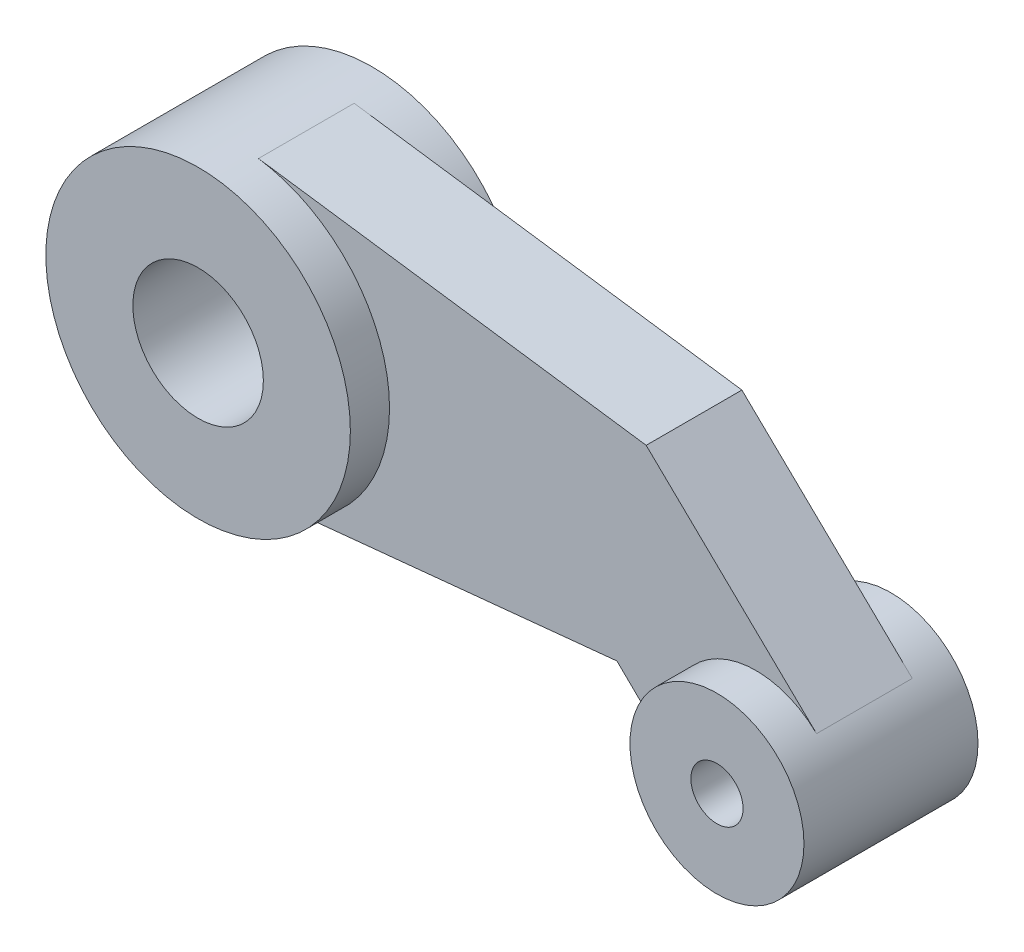
from build123d import *

# Parameters (mm, degrees)
ESQUISSE1_R             = 3
ESQUISSE1_R_2           = 7.5
BOSS_EXTRU_1_DEPTH      = 11
BOSS_EXTRU_2_DEPTH      = 15.5
BOSS_EXTRU_2_DEPTH_BACK = 4.5
ESQUISSE1_3_R           = 17.5
ESQUISSE1_3_R_2         = 7.5
ESQUISSE1_3_R_3         = 10
ESQUISSE1_3_R_4         = 3


with BuildPart() as part:
    # Esquisse1 → Boss.-Extru.1 (new body)
    with BuildSketch(Plane.XY):
        with BuildLine():
            Line((46.997592, 11.066902), (2.435529, 17.329691))
            ThreePointArc((2.435529, 17.329691), (-17.272219, -2.814332), (7.810886, -15.660142))
            Line((7.810886, -15.660142), (43.632384, -12.079599))
            Line((43.632384, -12.079599), (50.273259, -18.558336))
            ThreePointArc((50.273259, -18.558336), (65.124357, -23.392938), (66.578968, -7.842613))
            Line((66.578968, -7.842613), (46.997592, 11.066902))
        make_face()
        with Locations((59.632384, -15.036011)):
            Circle(ESQUISSE1_R, mode=Mode.SUBTRACT)
        Circle(ESQUISSE1_R_2, mode=Mode.SUBTRACT)
    extrude(amount=BOSS_EXTRU_1_DEPTH)

    # Esquisse1<3> → Boss.-Extru.2 (add, two sides: drawn at the far end of the back side and taken through both)
    # profile 1 of 2: a face of its own
    with BuildSketch(Plane.XY.offset(-BOSS_EXTRU_2_DEPTH_BACK)):
        Circle(ESQUISSE1_3_R)
        Circle(ESQUISSE1_3_R_2, mode=Mode.SUBTRACT)
    # profile 2 of 2: a face of its own
    with BuildSketch(Plane.XY.offset(-BOSS_EXTRU_2_DEPTH_BACK)):
        with Locations((59.632384, -15.036011)):
            Circle(ESQUISSE1_3_R_3)
        with Locations((59.632384, -15.036011)):
            Circle(ESQUISSE1_3_R_4, mode=Mode.SUBTRACT)
    extrude(amount=BOSS_EXTRU_2_DEPTH + BOSS_EXTRU_2_DEPTH_BACK)


solid = part.part
